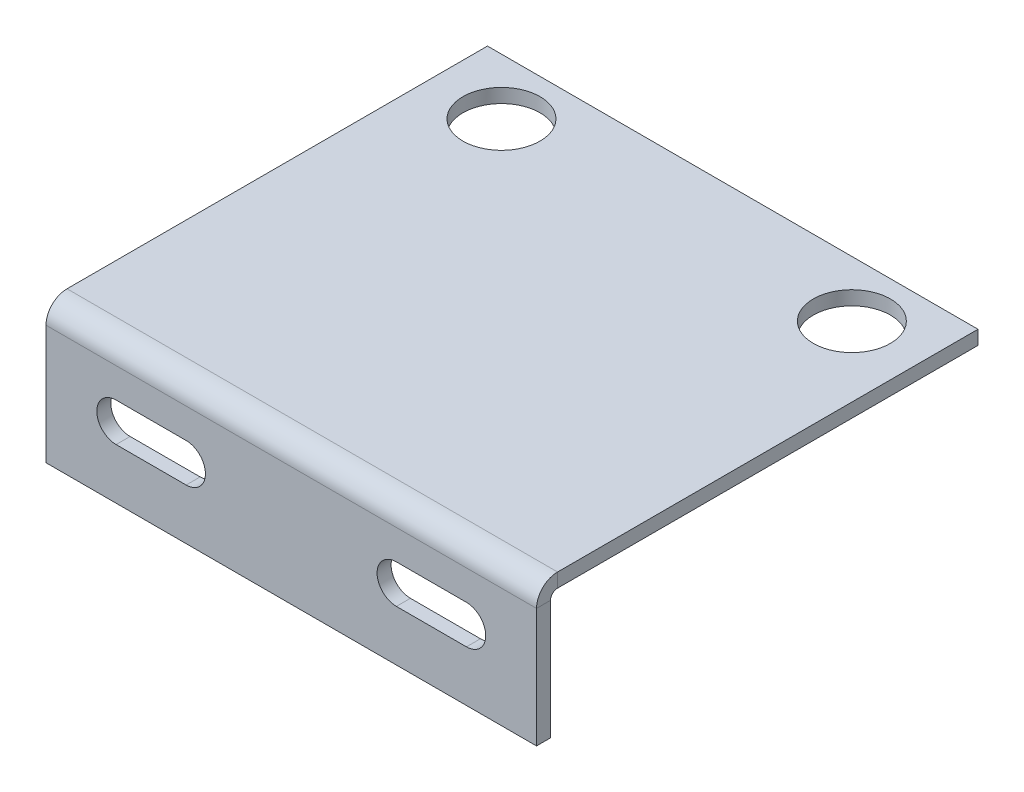
from build123d import *

# Parameters (mm, degrees)
SKETCH_1_W             = 70
SKETCH_1_H             = 60
SM_BASE_FLANGE_1_DEPTH = 2
SM_EDGE_FLANGE_1_DEPTH = 70
CUT_EXTRUDE_1_DEPTH    = 10
SKETCH_13_R            = 5.5
CUT_EXTRUDE_2_DEPTH    = 10


# Sheet-metal steps are written as plain solids
with BuildPart() as part:
    # Sketch 1 → 基体-法兰1 (new body)
    with BuildSketch(Plane(origin=(0, 0, 0), x_dir=(1, 0, 0), z_dir=(0, 1, 0))):
        with Locations((35, 30)):
            Rectangle(SKETCH_1_W, SKETCH_1_H)
    extrude(amount=-SM_BASE_FLANGE_1_DEPTH)

    # 边线-法兰1 section (across the edge) → 边线-法兰1 (add)
    with BuildSketch(Plane(origin=(70, -2, 1), x_dir=(0, 0, -1), z_dir=(-1, 0, 0))):
        with BuildLine():
            Line((-2, 1), (-2, 18))
            Line((-2, 18), (0, 18))
            Line((0, 18), (0, 1))
            ThreePointArc((0, 1), (0.292893219, 0.292893219), (1, 0))
            Line((1, 0), (1, -2))
            ThreePointArc((1, -2), (-1.121320344, -1.121320344), (-2, 1))
        make_face()
    extrude(amount=SM_EDGE_FLANGE_1_DEPTH)

    # 草图12 → 切除-拉伸1 (cut)
    with BuildSketch(Plane(origin=(0, 0, 1), x_dir=(-1, 0, 0), z_dir=(0, 0, -1))):
        with BuildLine():
            Line((-60, -7.25), (-50, -7.25))
            ThreePointArc((-50, -7.25), (-47.25, -10), (-50, -12.75))
            Line((-50, -12.75), (-60, -12.75))
            ThreePointArc((-60, -12.75), (-62.75, -10), (-60, -7.25))
        make_face()
        with BuildLine():
            Line((-10, -7.25), (-20, -7.25))
            ThreePointArc((-20, -7.25), (-22.75, -10), (-20, -12.75))
            Line((-20, -12.75), (-10, -12.75))
            ThreePointArc((-10, -12.75), (-7.25, -10), (-10, -7.25))
        make_face()
    extrude(amount=-CUT_EXTRUDE_1_DEPTH, mode=Mode.SUBTRACT)

    # 草图13 → 切除-拉伸2 (cut)
    with BuildSketch(Plane(origin=(0, 0, 0), x_dir=(1, 0, 0), z_dir=(0, 1, 0))):
        with Locations(Location((10, 52, 0), (0, 0, 270))):
            Circle(SKETCH_13_R)
        with Locations(Location((60, 52, 0), (0, 0, 270))):
            Circle(SKETCH_13_R)
    extrude(amount=-CUT_EXTRUDE_2_DEPTH, mode=Mode.SUBTRACT)


solid = part.part
